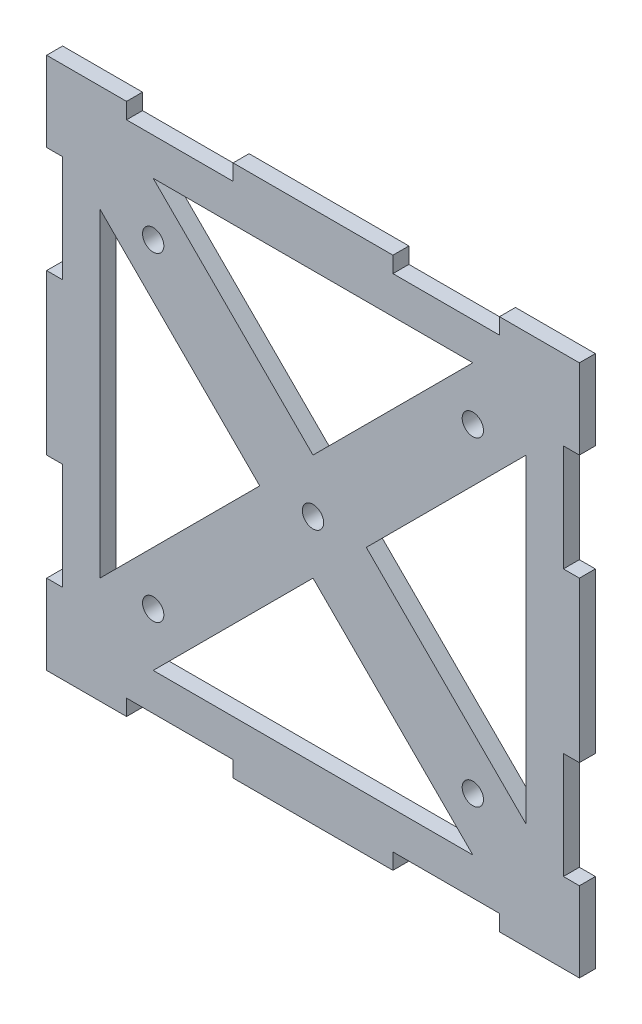
from build123d import *

# Parameters (mm, degrees)
ESQUISSE1_W             = 100
ESQUISSE1_H             = 100
ESQUISSE1_R             = 2
BOSS_EXTRU_1_DEPTH      = 3
ENL_V_MAT_EXTRU_1_REACH = 136.769
ESQUISSE2_W             = 3
ESQUISSE2_H             = 20
ESQUISSE2_W_2           = 20
ESQUISSE2_H_2           = 3


with BuildPart() as part:
    # Esquisse1 → Boss.-Extru.1 (new body)
    with BuildSketch(Plane.XY):
        with Locations((-36.351443344, 53.427454033)):
            Rectangle(ESQUISSE1_W, ESQUISSE1_H)
        Polygon((-76.351443344, 23.427454033), (-76.351443344, 83.427454033), (-46.351443344, 53.427454033), align=None, mode=Mode.SUBTRACT)
        Polygon((-6.351443344, 13.427454033), (-66.351443344, 13.427454033), (-36.351443344, 43.427454033), align=None, mode=Mode.SUBTRACT)
        Polygon((3.648556656, 83.427454033), (3.648556656, 23.427454033), (-26.351443344, 53.427454033), align=None, mode=Mode.SUBTRACT)
        Polygon((-66.351443344, 93.427454033), (-6.351443344, 93.427454033), (-36.351443344, 63.427454033), align=None, mode=Mode.SUBTRACT)
        with Locations((-6.351443344, 83.427454033)):
            Circle(ESQUISSE1_R, mode=Mode.SUBTRACT)
        with Locations((-66.351443344, 23.427454033)):
            Circle(ESQUISSE1_R, mode=Mode.SUBTRACT)
        with Locations((-6.351443344, 23.427454033)):
            Circle(ESQUISSE1_R, mode=Mode.SUBTRACT)
        with Locations((-36.351443344, 53.427454033)):
            Circle(ESQUISSE1_R, mode=Mode.SUBTRACT)
        with Locations((-66.351443344, 83.427454033)):
            Circle(ESQUISSE1_R, mode=Mode.SUBTRACT)
    extrude(amount=BOSS_EXTRU_1_DEPTH)

    # Esquisse2 → Enlèv. mat.-Extru.1 (cut, up to next)
    with BuildSketch(Plane.XY.offset(3), mode=Mode.PRIVATE) as enl_v_mat_extru_1_sk1:
        with Locations((-84.851443344, 28.427454033)):
            Rectangle(ESQUISSE2_W, ESQUISSE2_H)
    enl_v_mat_extru_1_tool1 = extrude(enl_v_mat_extru_1_sk1.sketch, amount=-ENL_V_MAT_EXTRU_1_REACH, mode=Mode.PRIVATE) & part.part
    # Esquisse2 → Enlèv. mat.-Extru.1 (cut, up to next)
    with BuildSketch(Plane.XY.offset(3), mode=Mode.PRIVATE) as enl_v_mat_extru_1_sk2:
        with Locations((-61.351443344, 101.927454033)):
            Rectangle(ESQUISSE2_W_2, ESQUISSE2_H_2)
    enl_v_mat_extru_1_tool2 = extrude(enl_v_mat_extru_1_sk2.sketch, amount=-ENL_V_MAT_EXTRU_1_REACH, mode=Mode.PRIVATE) & part.part
    # Esquisse2 → Enlèv. mat.-Extru.1 (cut, up to next)
    with BuildSketch(Plane.XY.offset(3), mode=Mode.PRIVATE) as enl_v_mat_extru_1_sk3:
        with Locations((-84.851443344, 78.427454033)):
            Rectangle(ESQUISSE2_W, ESQUISSE2_H)
    enl_v_mat_extru_1_tool3 = extrude(enl_v_mat_extru_1_sk3.sketch, amount=-ENL_V_MAT_EXTRU_1_REACH, mode=Mode.PRIVATE) & part.part
    # Esquisse2 → Enlèv. mat.-Extru.1 (cut, up to next)
    with BuildSketch(Plane.XY.offset(3), mode=Mode.PRIVATE) as enl_v_mat_extru_1_sk4:
        with Locations((-61.351443344, 4.927454033)):
            Rectangle(ESQUISSE2_W_2, ESQUISSE2_H_2)
    enl_v_mat_extru_1_tool4 = extrude(enl_v_mat_extru_1_sk4.sketch, amount=-ENL_V_MAT_EXTRU_1_REACH, mode=Mode.PRIVATE) & part.part
    # Esquisse2 → Enlèv. mat.-Extru.1 (cut, up to next)
    with BuildSketch(Plane.XY.offset(3), mode=Mode.PRIVATE) as enl_v_mat_extru_1_sk5:
        with Locations((-11.351443344, 4.927454033)):
            Rectangle(ESQUISSE2_W_2, ESQUISSE2_H_2)
    enl_v_mat_extru_1_tool5 = extrude(enl_v_mat_extru_1_sk5.sketch, amount=-ENL_V_MAT_EXTRU_1_REACH, mode=Mode.PRIVATE) & part.part
    # Esquisse2 → Enlèv. mat.-Extru.1 (cut, up to next)
    with BuildSketch(Plane.XY.offset(3), mode=Mode.PRIVATE) as enl_v_mat_extru_1_sk6:
        with Locations((12.148556656, 28.427454033)):
            Rectangle(ESQUISSE2_W, ESQUISSE2_H)
    enl_v_mat_extru_1_tool6 = extrude(enl_v_mat_extru_1_sk6.sketch, amount=-ENL_V_MAT_EXTRU_1_REACH, mode=Mode.PRIVATE) & part.part
    # Esquisse2 → Enlèv. mat.-Extru.1 (cut, up to next)
    with BuildSketch(Plane.XY.offset(3), mode=Mode.PRIVATE) as enl_v_mat_extru_1_sk7:
        with Locations((12.148556656, 78.427454033)):
            Rectangle(ESQUISSE2_W, ESQUISSE2_H)
    enl_v_mat_extru_1_tool7 = extrude(enl_v_mat_extru_1_sk7.sketch, amount=-ENL_V_MAT_EXTRU_1_REACH, mode=Mode.PRIVATE) & part.part
    # Esquisse2 → Enlèv. mat.-Extru.1 (cut, up to next)
    with BuildSketch(Plane.XY.offset(3), mode=Mode.PRIVATE) as enl_v_mat_extru_1_sk8:
        with Locations((-11.351443344, 101.927454033)):
            Rectangle(ESQUISSE2_W_2, ESQUISSE2_H_2)
    enl_v_mat_extru_1_tool8 = extrude(enl_v_mat_extru_1_sk8.sketch, amount=-ENL_V_MAT_EXTRU_1_REACH, mode=Mode.PRIVATE) & part.part
    add(enl_v_mat_extru_1_tool1.solids().sort_by_distance((-84.851443, 28.427454, 3))[0], mode=Mode.SUBTRACT)
    add(enl_v_mat_extru_1_tool2.solids().sort_by_distance((-61.351443, 101.927454, 3))[0], mode=Mode.SUBTRACT)
    add(enl_v_mat_extru_1_tool3.solids().sort_by_distance((-84.851443, 78.427454, 3))[0], mode=Mode.SUBTRACT)
    add(enl_v_mat_extru_1_tool4.solids().sort_by_distance((-61.351443, 4.927454, 3))[0], mode=Mode.SUBTRACT)
    add(enl_v_mat_extru_1_tool5.solids().sort_by_distance((-11.351443, 4.927454, 3))[0], mode=Mode.SUBTRACT)
    add(enl_v_mat_extru_1_tool6.solids().sort_by_distance((12.148557, 28.427454, 3))[0], mode=Mode.SUBTRACT)
    add(enl_v_mat_extru_1_tool7.solids().sort_by_distance((12.148557, 78.427454, 3))[0], mode=Mode.SUBTRACT)
    add(enl_v_mat_extru_1_tool8.solids().sort_by_distance((-11.351443, 101.927454, 3))[0], mode=Mode.SUBTRACT)


solid = part.part
